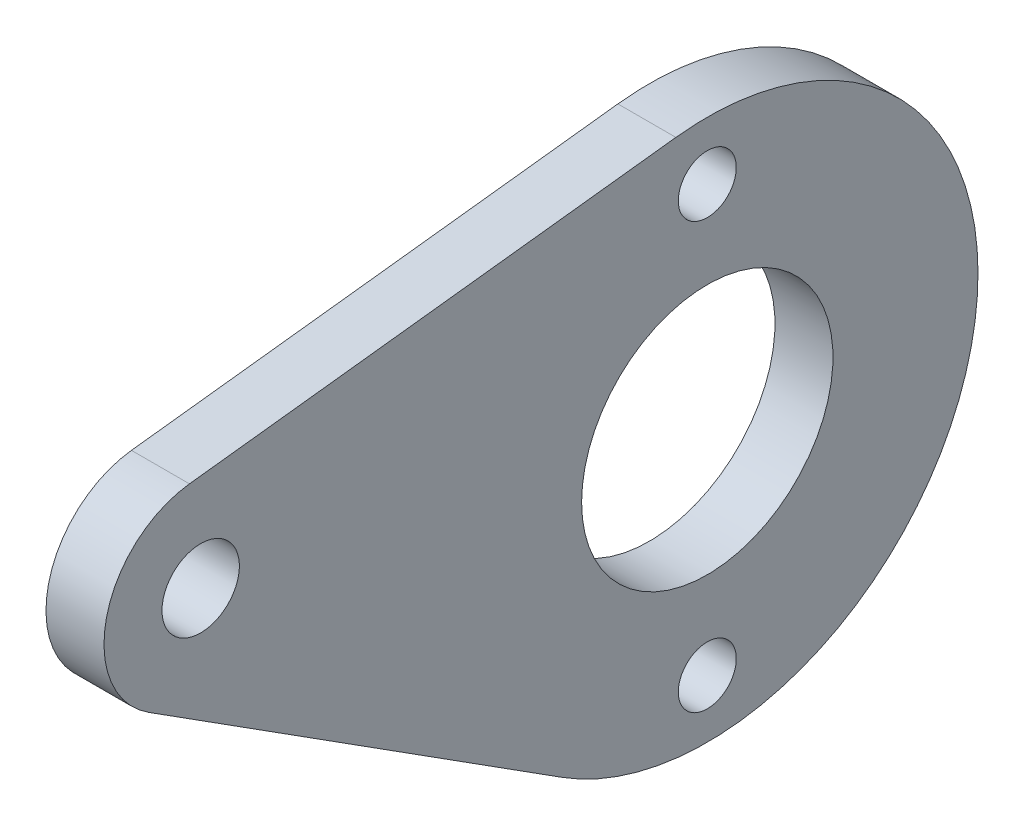
from build123d import *

# Parameters (mm, degrees)
ESQUISSE1_R        = 6.5
ESQUISSE1_R_2      = 1.5
ESQUISSE1_R_3      = 2
BOSS_EXTRU_1_DEPTH = 3


with BuildPart() as part:
    # Esquisse1 → Boss.-Extru.1 (new body)
    with BuildSketch(Plane.ZY):
        with BuildLine():
            Line((28.883683038, 1.781250736), (7.514312505, -11.81249794))
            ThreePointArc((7.514312505, -11.81249794), (-13.646724843, -3.125204163), (1.624716341, 13.905405309))
            Line((1.624716341, 13.905405309), (26.780255836, 10.966216182))
            ThreePointArc((26.780255836, 10.966216182), (31.073830301, 7.116144344), (28.883683038, 1.781250736))
        make_face()
        Circle(ESQUISSE1_R, mode=Mode.SUBTRACT)
        with Locations((0, 11)):
            Circle(ESQUISSE1_R_2, mode=Mode.SUBTRACT)
        with Locations((0, -11)):
            Circle(ESQUISSE1_R_2, mode=Mode.SUBTRACT)
        with Locations((26.2, 6)):
            Circle(ESQUISSE1_R_3, mode=Mode.SUBTRACT)
    extrude(amount=-BOSS_EXTRU_1_DEPTH)


solid = part.part
